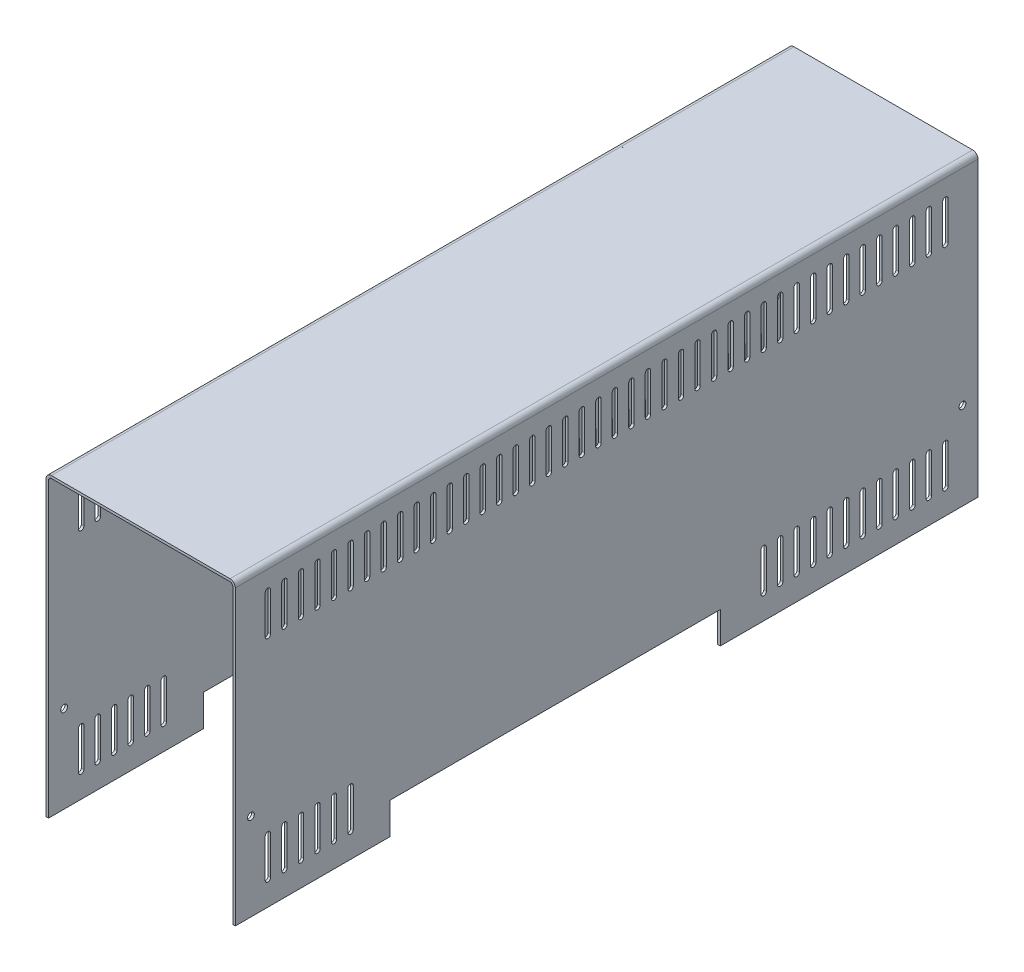
from build123d import *

# Parameters (mm, degrees)
BASE_FLANGE1_DEPTH      = 425.49
SKETCH6_W               = 193.4
SKETCH6_H               = 18.5
CUT_EXTRUDE1_DEPTH      = 473.550695799
CUT_EXTRUDE2_DEPTH      = 473.550695799
CUT_EXTRUDE2_DEPTH_BACK = 473.550695799
SKETCH7_R               = 2
CUT_EXTRUDE3_DEPTH      = 473.550695799
BOSS_EXTRUDE1_DEPTH     = 4.76
BOSS_EXTRUDE2_START     = 4.76
BOSS_EXTRUDE2_DEPTH     = 4.76


# Sheet-metal steps are written as plain solids
with BuildPart() as part:
    # Sketch1 → Base-Flange1 (new body)
    with BuildSketch(Plane.XY):
        with BuildLine():
            Line((0, -173.1), (0, -1.6))
            ThreePointArc((0, -1.6), (0.46862915, -0.46862915), (1.6, 0))
            Line((1.6, 0), (106.3, 0))
            ThreePointArc((106.3, 0), (107.43137085, -0.46862915), (107.9, -1.6))
            Line((107.9, -1.6), (107.9, -173.1))
            Line((107.9, -173.1), (109.4, -173.1))
            Line((109.4, -173.1), (109.4, -1.6))
            ThreePointArc((109.4, -1.6), (108.492031022, 0.592031022), (106.3, 1.5))
            Line((106.3, 1.5), (1.6, 1.5))
            ThreePointArc((1.6, 1.5), (-0.592031022, 0.592031022), (-1.5, -1.6))
            Line((-1.5, -1.6), (-1.5, -173.1))
            Line((-1.5, -173.1), (0, -173.1))
        make_face()
    extrude(amount=-BASE_FLANGE1_DEPTH)

    # Sketch6 → Cut-Extrude1 (cut, through all)
    with BuildSketch(Plane(origin=(109.4, 0, 0), x_dir=(0, 0, -1), z_dir=(1, 0, 0))):
        with Locations((182.6, -163.85)):
            Rectangle(SKETCH6_W, SKETCH6_H)
    extrude(amount=-CUT_EXTRUDE1_DEPTH, mode=Mode.SUBTRACT)

    # Sketch7 → Cut-Extrude2 (cut, two sides: drawn at the far end of the back side and taken through both)
    with BuildSketch(Plane(origin=(109.4, 0, 0), x_dir=(0, 0, -1), z_dir=(1, 0, 0)).offset(-CUT_EXTRUDE2_DEPTH_BACK)):
        with Locations(Location((421.14, -122.01, 0), (0, 0, 90))):
            Circle(SKETCH7_R)
        with Locations(Location((4.35, -122.01, 0), (0, 0, 90))):
            Circle(SKETCH7_R)
    extrude(amount=CUT_EXTRUDE2_DEPTH + CUT_EXTRUDE2_DEPTH_BACK, mode=Mode.SUBTRACT)

    # Sketch8 → Cut-Extrude3 (cut, through all)
    with BuildSketch(Plane(origin=(109.4, 0, 0), x_dir=(0, 0, -1), z_dir=(1, 0, 0))):
        with BuildLine():
            Line((15.925, -12.8375), (15.925, -35.2425))
            ThreePointArc((15.925, -35.2425), (14.3375, -36.83), (12.75, -35.2425))
            Line((12.75, -35.2425), (12.75, -12.8375))
            ThreePointArc((12.75, -12.8375), (14.3375, -11.25), (15.925, -12.8375))
        make_face()
        with BuildLine():
            Line((25.603, -12.8375), (25.603, -35.2425))
            ThreePointArc((25.603, -35.2425), (24.0155, -36.83), (22.428, -35.2425))
            Line((22.428, -35.2425), (22.428, -12.8375))
            ThreePointArc((22.428, -12.8375), (24.0155, -11.25), (25.603, -12.8375))
        make_face()
        with BuildLine():
            Line((35.281, -12.8375), (35.281, -35.2425))
            ThreePointArc((35.281, -35.2425), (33.6935, -36.83), (32.106, -35.2425))
            Line((32.106, -35.2425), (32.106, -12.8375))
            ThreePointArc((32.106, -12.8375), (33.6935, -11.25), (35.281, -12.8375))
        make_face()
        with BuildLine():
            Line((44.959, -12.8375), (44.959, -35.2425))
            ThreePointArc((44.959, -35.2425), (43.3715, -36.83), (41.784, -35.2425))
            Line((41.784, -35.2425), (41.784, -12.8375))
            ThreePointArc((41.784, -12.8375), (43.3715, -11.25), (44.959, -12.8375))
        make_face()
        with BuildLine():
            Line((54.637, -12.8375), (54.637, -35.2425))
            ThreePointArc((54.637, -35.2425), (53.0495, -36.83), (51.462, -35.2425))
            Line((51.462, -35.2425), (51.462, -12.8375))
            ThreePointArc((51.462, -12.8375), (53.0495, -11.25), (54.637, -12.8375))
        make_face()
        with BuildLine():
            Line((64.315, -12.8375), (64.315, -35.2425))
            ThreePointArc((64.315, -35.2425), (62.7275, -36.83), (61.14, -35.2425))
            Line((61.14, -35.2425), (61.14, -12.8375))
            ThreePointArc((61.14, -12.8375), (62.7275, -11.25), (64.315, -12.8375))
        make_face()
        with BuildLine():
            Line((73.993, -12.8375), (73.993, -35.2425))
            ThreePointArc((73.993, -35.2425), (72.4055, -36.83), (70.818, -35.2425))
            Line((70.818, -35.2425), (70.818, -12.8375))
            ThreePointArc((70.818, -12.8375), (72.4055, -11.25), (73.993, -12.8375))
        make_face()
        with BuildLine():
            Line((83.671, -12.8375), (83.671, -35.2425))
            ThreePointArc((83.671, -35.2425), (82.0835, -36.83), (80.496, -35.2425))
            Line((80.496, -35.2425), (80.496, -12.8375))
            ThreePointArc((80.496, -12.8375), (82.0835, -11.25), (83.671, -12.8375))
        make_face()
        with BuildLine():
            Line((93.349, -12.8375), (93.349, -35.2425))
            ThreePointArc((93.349, -35.2425), (91.7615, -36.83), (90.174, -35.2425))
            Line((90.174, -35.2425), (90.174, -12.8375))
            ThreePointArc((90.174, -12.8375), (91.7615, -11.25), (93.349, -12.8375))
        make_face()
        with BuildLine():
            Line((103.027, -12.8375), (103.027, -35.2425))
            ThreePointArc((103.027, -35.2425), (101.4395, -36.83), (99.852, -35.2425))
            Line((99.852, -35.2425), (99.852, -12.8375))
            ThreePointArc((99.852, -12.8375), (101.4395, -11.25), (103.027, -12.8375))
        make_face()
        with BuildLine():
            Line((112.705, -12.8375), (112.705, -35.2425))
            ThreePointArc((112.705, -35.2425), (111.1175, -36.83), (109.53, -35.2425))
            Line((109.53, -35.2425), (109.53, -12.8375))
            ThreePointArc((109.53, -12.8375), (111.1175, -11.25), (112.705, -12.8375))
        make_face()
        with BuildLine():
            Line((122.383, -12.8375), (122.383, -35.2425))
            ThreePointArc((122.383, -35.2425), (120.7955, -36.83), (119.208, -35.2425))
            Line((119.208, -35.2425), (119.208, -12.8375))
            ThreePointArc((119.208, -12.8375), (120.7955, -11.25), (122.383, -12.8375))
        make_face()
        with BuildLine():
            Line((132.061, -12.8375), (132.061, -35.2425))
            ThreePointArc((132.061, -35.2425), (130.4735, -36.83), (128.886, -35.2425))
            Line((128.886, -35.2425), (128.886, -12.8375))
            ThreePointArc((128.886, -12.8375), (130.4735, -11.25), (132.061, -12.8375))
        make_face()
        with BuildLine():
            Line((141.739, -12.8375), (141.739, -35.2425))
            ThreePointArc((141.739, -35.2425), (140.1515, -36.83), (138.564, -35.2425))
            Line((138.564, -35.2425), (138.564, -12.8375))
            ThreePointArc((138.564, -12.8375), (140.1515, -11.25), (141.739, -12.8375))
        make_face()
        with BuildLine():
            Line((151.417, -12.8375), (151.417, -35.2425))
            ThreePointArc((151.417, -35.2425), (149.8295, -36.83), (148.242, -35.2425))
            Line((148.242, -35.2425), (148.242, -12.8375))
            ThreePointArc((148.242, -12.8375), (149.8295, -11.25), (151.417, -12.8375))
        make_face()
        with BuildLine():
            Line((161.095, -12.8375), (161.095, -35.2425))
            ThreePointArc((161.095, -35.2425), (159.5075, -36.83), (157.92, -35.2425))
            Line((157.92, -35.2425), (157.92, -12.8375))
            ThreePointArc((157.92, -12.8375), (159.5075, -11.25), (161.095, -12.8375))
        make_face()
        with BuildLine():
            Line((170.773, -12.8375), (170.773, -35.2425))
            ThreePointArc((170.773, -35.2425), (169.1855, -36.83), (167.598, -35.2425))
            Line((167.598, -35.2425), (167.598, -12.8375))
            ThreePointArc((167.598, -12.8375), (169.1855, -11.25), (170.773, -12.8375))
        make_face()
        with BuildLine():
            Line((180.451, -12.8375), (180.451, -35.2425))
            ThreePointArc((180.451, -35.2425), (178.8635, -36.83), (177.276, -35.2425))
            Line((177.276, -35.2425), (177.276, -12.8375))
            ThreePointArc((177.276, -12.8375), (178.8635, -11.25), (180.451, -12.8375))
        make_face()
        with BuildLine():
            Line((190.129, -12.8375), (190.129, -35.2425))
            ThreePointArc((190.129, -35.2425), (188.5415, -36.83), (186.954, -35.2425))
            Line((186.954, -35.2425), (186.954, -12.8375))
            ThreePointArc((186.954, -12.8375), (188.5415, -11.25), (190.129, -12.8375))
        make_face()
        with BuildLine():
            Line((199.807, -12.8375), (199.807, -35.2425))
            ThreePointArc((199.807, -35.2425), (198.2195, -36.83), (196.632, -35.2425))
            Line((196.632, -35.2425), (196.632, -12.8375))
            ThreePointArc((196.632, -12.8375), (198.2195, -11.25), (199.807, -12.8375))
        make_face()
        with BuildLine():
            Line((209.485, -12.8375), (209.485, -35.2425))
            ThreePointArc((209.485, -35.2425), (207.8975, -36.83), (206.31, -35.2425))
            Line((206.31, -35.2425), (206.31, -12.8375))
            ThreePointArc((206.31, -12.8375), (207.8975, -11.25), (209.485, -12.8375))
        make_face()
        with BuildLine():
            Line((219.163, -12.8375), (219.163, -35.2425))
            ThreePointArc((219.163, -35.2425), (217.5755, -36.83), (215.988, -35.2425))
            Line((215.988, -35.2425), (215.988, -12.8375))
            ThreePointArc((215.988, -12.8375), (217.5755, -11.25), (219.163, -12.8375))
        make_face()
        with BuildLine():
            Line((228.841, -12.8375), (228.841, -35.2425))
            ThreePointArc((228.841, -35.2425), (227.2535, -36.83), (225.666, -35.2425))
            Line((225.666, -35.2425), (225.666, -12.8375))
            ThreePointArc((225.666, -12.8375), (227.2535, -11.25), (228.841, -12.8375))
        make_face()
        with BuildLine():
            Line((238.519, -12.8375), (238.519, -35.2425))
            ThreePointArc((238.519, -35.2425), (236.9315, -36.83), (235.344, -35.2425))
            Line((235.344, -35.2425), (235.344, -12.8375))
            ThreePointArc((235.344, -12.8375), (236.9315, -11.25), (238.519, -12.8375))
        make_face()
        with BuildLine():
            Line((248.197, -12.8375), (248.197, -35.2425))
            ThreePointArc((248.197, -35.2425), (246.6095, -36.83), (245.022, -35.2425))
            Line((245.022, -35.2425), (245.022, -12.8375))
            ThreePointArc((245.022, -12.8375), (246.6095, -11.25), (248.197, -12.8375))
        make_face()
        with BuildLine():
            Line((257.875, -12.8375), (257.875, -35.2425))
            ThreePointArc((257.875, -35.2425), (256.2875, -36.83), (254.7, -35.2425))
            Line((254.7, -35.2425), (254.7, -12.8375))
            ThreePointArc((254.7, -12.8375), (256.2875, -11.25), (257.875, -12.8375))
        make_face()
        with BuildLine():
            Line((267.553, -12.8375), (267.553, -35.2425))
            ThreePointArc((267.553, -35.2425), (265.9655, -36.83), (264.378, -35.2425))
            Line((264.378, -35.2425), (264.378, -12.8375))
            ThreePointArc((264.378, -12.8375), (265.9655, -11.25), (267.553, -12.8375))
        make_face()
        with BuildLine():
            Line((277.231, -12.8375), (277.231, -35.2425))
            ThreePointArc((277.231, -35.2425), (275.6435, -36.83), (274.056, -35.2425))
            Line((274.056, -35.2425), (274.056, -12.8375))
            ThreePointArc((274.056, -12.8375), (275.6435, -11.25), (277.231, -12.8375))
        make_face()
        with BuildLine():
            Line((286.909, -12.8375), (286.909, -35.2425))
            ThreePointArc((286.909, -35.2425), (285.3215, -36.83), (283.734, -35.2425))
            Line((283.734, -35.2425), (283.734, -12.8375))
            ThreePointArc((283.734, -12.8375), (285.3215, -11.25), (286.909, -12.8375))
        make_face()
        with BuildLine():
            Line((296.587, -12.8375), (296.587, -35.2425))
            ThreePointArc((296.587, -35.2425), (294.9995, -36.83), (293.412, -35.2425))
            Line((293.412, -35.2425), (293.412, -12.8375))
            ThreePointArc((293.412, -12.8375), (294.9995, -11.25), (296.587, -12.8375))
        make_face()
        with BuildLine():
            Line((306.265, -12.8375), (306.265, -35.2425))
            ThreePointArc((306.265, -35.2425), (304.6775, -36.83), (303.09, -35.2425))
            Line((303.09, -35.2425), (303.09, -12.8375))
            ThreePointArc((303.09, -12.8375), (304.6775, -11.25), (306.265, -12.8375))
        make_face()
        with BuildLine():
            Line((315.943, -12.8375), (315.943, -35.2425))
            ThreePointArc((315.943, -35.2425), (314.3555, -36.83), (312.768, -35.2425))
            Line((312.768, -35.2425), (312.768, -12.8375))
            ThreePointArc((312.768, -12.8375), (314.3555, -11.25), (315.943, -12.8375))
        make_face()
        with BuildLine():
            Line((325.621, -12.8375), (325.621, -35.2425))
            ThreePointArc((325.621, -35.2425), (324.0335, -36.83), (322.446, -35.2425))
            Line((322.446, -35.2425), (322.446, -12.8375))
            ThreePointArc((322.446, -12.8375), (324.0335, -11.25), (325.621, -12.8375))
        make_face()
        with BuildLine():
            Line((335.299, -12.8375), (335.299, -35.2425))
            ThreePointArc((335.299, -35.2425), (333.7115, -36.83), (332.124, -35.2425))
            Line((332.124, -35.2425), (332.124, -12.8375))
            ThreePointArc((332.124, -12.8375), (333.7115, -11.25), (335.299, -12.8375))
        make_face()
        with BuildLine():
            Line((344.977, -12.8375), (344.977, -35.2425))
            ThreePointArc((344.977, -35.2425), (343.3895, -36.83), (341.802, -35.2425))
            Line((341.802, -35.2425), (341.802, -12.8375))
            ThreePointArc((341.802, -12.8375), (343.3895, -11.25), (344.977, -12.8375))
        make_face()
        with BuildLine():
            Line((354.655, -12.8375), (354.655, -35.2425))
            ThreePointArc((354.655, -35.2425), (353.0675, -36.83), (351.48, -35.2425))
            Line((351.48, -35.2425), (351.48, -12.8375))
            ThreePointArc((351.48, -12.8375), (353.0675, -11.25), (354.655, -12.8375))
        make_face()
        with BuildLine():
            Line((364.333, -12.8375), (364.333, -35.2425))
            ThreePointArc((364.333, -35.2425), (362.7455, -36.83), (361.158, -35.2425))
            Line((361.158, -35.2425), (361.158, -12.8375))
            ThreePointArc((361.158, -12.8375), (362.7455, -11.25), (364.333, -12.8375))
        make_face()
        with BuildLine():
            Line((374.011, -12.8375), (374.011, -35.2425))
            ThreePointArc((374.011, -35.2425), (372.4235, -36.83), (370.836, -35.2425))
            Line((370.836, -35.2425), (370.836, -12.8375))
            ThreePointArc((370.836, -12.8375), (372.4235, -11.25), (374.011, -12.8375))
        make_face()
        with BuildLine():
            Line((383.689, -12.8375), (383.689, -35.2425))
            ThreePointArc((383.689, -35.2425), (382.1015, -36.83), (380.514, -35.2425))
            Line((380.514, -35.2425), (380.514, -12.8375))
            ThreePointArc((380.514, -12.8375), (382.1015, -11.25), (383.689, -12.8375))
        make_face()
        with BuildLine():
            Line((393.367, -12.8375), (393.367, -35.2425))
            ThreePointArc((393.367, -35.2425), (391.7795, -36.83), (390.192, -35.2425))
            Line((390.192, -35.2425), (390.192, -12.8375))
            ThreePointArc((390.192, -12.8375), (391.7795, -11.25), (393.367, -12.8375))
        make_face()
        with BuildLine():
            Line((403.045, -12.8375), (403.045, -35.2425))
            ThreePointArc((403.045, -35.2425), (401.4575, -36.83), (399.87, -35.2425))
            Line((399.87, -35.2425), (399.87, -12.8375))
            ThreePointArc((399.87, -12.8375), (401.4575, -11.25), (403.045, -12.8375))
        make_face()
        with BuildLine():
            Line((412.723, -12.8375), (412.723, -35.2425))
            ThreePointArc((412.723, -35.2425), (411.1355, -36.83), (409.548, -35.2425))
            Line((409.548, -35.2425), (409.548, -12.8375))
            ThreePointArc((409.548, -12.8375), (411.1355, -11.25), (412.723, -12.8375))
        make_face()
        with BuildLine():
            Line((15.925, -136.3575), (15.925, -158.7625))
            ThreePointArc((15.925, -158.7625), (14.3375, -160.35), (12.75, -158.7625))
            Line((12.75, -158.7625), (12.75, -136.3575))
            ThreePointArc((12.75, -136.3575), (14.3375, -134.77), (15.925, -136.3575))
        make_face()
        with BuildLine():
            Line((25.603, -136.3575), (25.603, -158.7625))
            ThreePointArc((25.603, -158.7625), (24.0155, -160.35), (22.428, -158.7625))
            Line((22.428, -158.7625), (22.428, -136.3575))
            ThreePointArc((22.428, -136.3575), (24.0155, -134.77), (25.603, -136.3575))
        make_face()
        with BuildLine():
            Line((35.281, -136.3575), (35.281, -158.7625))
            ThreePointArc((35.281, -158.7625), (33.6935, -160.35), (32.106, -158.7625))
            Line((32.106, -158.7625), (32.106, -136.3575))
            ThreePointArc((32.106, -136.3575), (33.6935, -134.77), (35.281, -136.3575))
        make_face()
        with BuildLine():
            Line((44.959, -136.3575), (44.959, -158.7625))
            ThreePointArc((44.959, -158.7625), (43.3715, -160.35), (41.784, -158.7625))
            Line((41.784, -158.7625), (41.784, -136.3575))
            ThreePointArc((41.784, -136.3575), (43.3715, -134.77), (44.959, -136.3575))
        make_face()
        with BuildLine():
            Line((54.637, -136.3575), (54.637, -158.7625))
            ThreePointArc((54.637, -158.7625), (53.0495, -160.35), (51.462, -158.7625))
            Line((51.462, -158.7625), (51.462, -136.3575))
            ThreePointArc((51.462, -136.3575), (53.0495, -134.77), (54.637, -136.3575))
        make_face()
        with BuildLine():
            Line((64.315, -136.3575), (64.315, -158.7625))
            ThreePointArc((64.315, -158.7625), (62.7275, -160.35), (61.14, -158.7625))
            Line((61.14, -158.7625), (61.14, -136.3575))
            ThreePointArc((61.14, -136.3575), (62.7275, -134.77), (64.315, -136.3575))
        make_face()
        with BuildLine():
            Line((306.265, -136.3575), (306.265, -158.7625))
            ThreePointArc((306.265, -158.7625), (304.6775, -160.35), (303.09, -158.7625))
            Line((303.09, -158.7625), (303.09, -136.3575))
            ThreePointArc((303.09, -136.3575), (304.6775, -134.77), (306.265, -136.3575))
        make_face()
        with BuildLine():
            Line((315.943, -136.3575), (315.943, -158.7625))
            ThreePointArc((315.943, -158.7625), (314.3555, -160.35), (312.768, -158.7625))
            Line((312.768, -158.7625), (312.768, -136.3575))
            ThreePointArc((312.768, -136.3575), (314.3555, -134.77), (315.943, -136.3575))
        make_face()
        with BuildLine():
            Line((325.621, -136.3575), (325.621, -158.7625))
            ThreePointArc((325.621, -158.7625), (324.0335, -160.35), (322.446, -158.7625))
            Line((322.446, -158.7625), (322.446, -136.3575))
            ThreePointArc((322.446, -136.3575), (324.0335, -134.77), (325.621, -136.3575))
        make_face()
        with BuildLine():
            Line((335.299, -136.3575), (335.299, -158.7625))
            ThreePointArc((335.299, -158.7625), (333.7115, -160.35), (332.124, -158.7625))
            Line((332.124, -158.7625), (332.124, -136.3575))
            ThreePointArc((332.124, -136.3575), (333.7115, -134.77), (335.299, -136.3575))
        make_face()
        with BuildLine():
            Line((344.977, -136.3575), (344.977, -158.7625))
            ThreePointArc((344.977, -158.7625), (343.3895, -160.35), (341.802, -158.7625))
            Line((341.802, -158.7625), (341.802, -136.3575))
            ThreePointArc((341.802, -136.3575), (343.3895, -134.77), (344.977, -136.3575))
        make_face()
        with BuildLine():
            Line((354.655, -136.3575), (354.655, -158.7625))
            ThreePointArc((354.655, -158.7625), (353.0675, -160.35), (351.48, -158.7625))
            Line((351.48, -158.7625), (351.48, -136.3575))
            ThreePointArc((351.48, -136.3575), (353.0675, -134.77), (354.655, -136.3575))
        make_face()
        with BuildLine():
            Line((364.333, -136.3575), (364.333, -158.7625))
            ThreePointArc((364.333, -158.7625), (362.7455, -160.35), (361.158, -158.7625))
            Line((361.158, -158.7625), (361.158, -136.3575))
            ThreePointArc((361.158, -136.3575), (362.7455, -134.77), (364.333, -136.3575))
        make_face()
        with BuildLine():
            Line((374.011, -136.3575), (374.011, -158.7625))
            ThreePointArc((374.011, -158.7625), (372.4235, -160.35), (370.836, -158.7625))
            Line((370.836, -158.7625), (370.836, -136.3575))
            ThreePointArc((370.836, -136.3575), (372.4235, -134.77), (374.011, -136.3575))
        make_face()
        with BuildLine():
            Line((383.689, -136.3575), (383.689, -158.7625))
            ThreePointArc((383.689, -158.7625), (382.1015, -160.35), (380.514, -158.7625))
            Line((380.514, -158.7625), (380.514, -136.3575))
            ThreePointArc((380.514, -136.3575), (382.1015, -134.77), (383.689, -136.3575))
        make_face()
        with BuildLine():
            Line((393.367, -136.3575), (393.367, -158.7625))
            ThreePointArc((393.367, -158.7625), (391.7795, -160.35), (390.192, -158.7625))
            Line((390.192, -158.7625), (390.192, -136.3575))
            ThreePointArc((390.192, -136.3575), (391.7795, -134.77), (393.367, -136.3575))
        make_face()
        with BuildLine():
            Line((403.045, -136.3575), (403.045, -158.7625))
            ThreePointArc((403.045, -158.7625), (401.4575, -160.35), (399.87, -158.7625))
            Line((399.87, -158.7625), (399.87, -136.3575))
            ThreePointArc((399.87, -136.3575), (401.4575, -134.77), (403.045, -136.3575))
        make_face()
        with BuildLine():
            Line((412.723, -136.3575), (412.723, -158.7625))
            ThreePointArc((412.723, -158.7625), (411.1355, -160.35), (409.548, -158.7625))
            Line((409.548, -158.7625), (409.548, -136.3575))
            ThreePointArc((409.548, -136.3575), (411.1355, -134.77), (412.723, -136.3575))
        make_face()
    extrude(amount=-CUT_EXTRUDE3_DEPTH, mode=Mode.SUBTRACT)

    # Sketch9 → Boss-Extrude1 (add)
    with BuildSketch(Plane(origin=(0, 0, -425.49), x_dir=(-1, 0, 0), z_dir=(0, 0, -1))):
        with BuildLine():
            Line((1.5, -173.1), (1.5, -1.6))
            ThreePointArc((1.5, -1.6), (0.592031022, 0.592031022), (-1.6, 1.5))
            Line((-1.6, 1.5), (-106.3, 1.5))
            ThreePointArc((-106.3, 1.5), (-108.492031022, 0.592031022), (-109.4, -1.6))
            Line((-109.4, -1.6), (-109.4, -173.1))
            Line((-109.4, -173.1), (-107.9, -173.1))
            Line((-107.9, -173.1), (-107.9, -1.6))
            ThreePointArc((-107.9, -1.6), (-107.43137085, -0.46862915), (-106.3, 0))
            Line((-106.3, 0), (-1.6, 0))
            ThreePointArc((-1.6, 0), (-0.46862915, -0.46862915), (0, -1.6))
            Line((0, -1.6), (0, -173.1))
            Line((0, -173.1), (1.5, -173.1))
        make_face()
    extrude(amount=BOSS_EXTRUDE1_DEPTH)

    # Sketch11 → Boss-Extrude2 (add)
    with BuildSketch(Plane.XY.offset(BOSS_EXTRUDE2_START)):
        with BuildLine():
            Line((109.4, -173.1), (109.4, -1.6))
            ThreePointArc((109.4, -1.6), (108.492031022, 0.592031022), (106.3, 1.5))
            Line((106.3, 1.5), (1.6, 1.5))
            ThreePointArc((1.6, 1.5), (-0.592031022, 0.592031022), (-1.5, -1.6))
            Line((-1.5, -1.6), (-1.5, -173.1))
            Line((-1.5, -173.1), (0, -173.1))
            Line((0, -173.1), (0, -1.6))
            ThreePointArc((0, -1.6), (0.46862915, -0.46862915), (1.6, 0))
            Line((1.6, 0), (106.3, 0))
            ThreePointArc((106.3, 0), (107.43137085, -0.46862915), (107.9, -1.6))
            Line((107.9, -1.6), (107.9, -173.1))
            Line((107.9, -173.1), (109.4, -173.1))
        make_face()
    extrude(amount=-BOSS_EXTRUDE2_DEPTH)


solid = part.part
